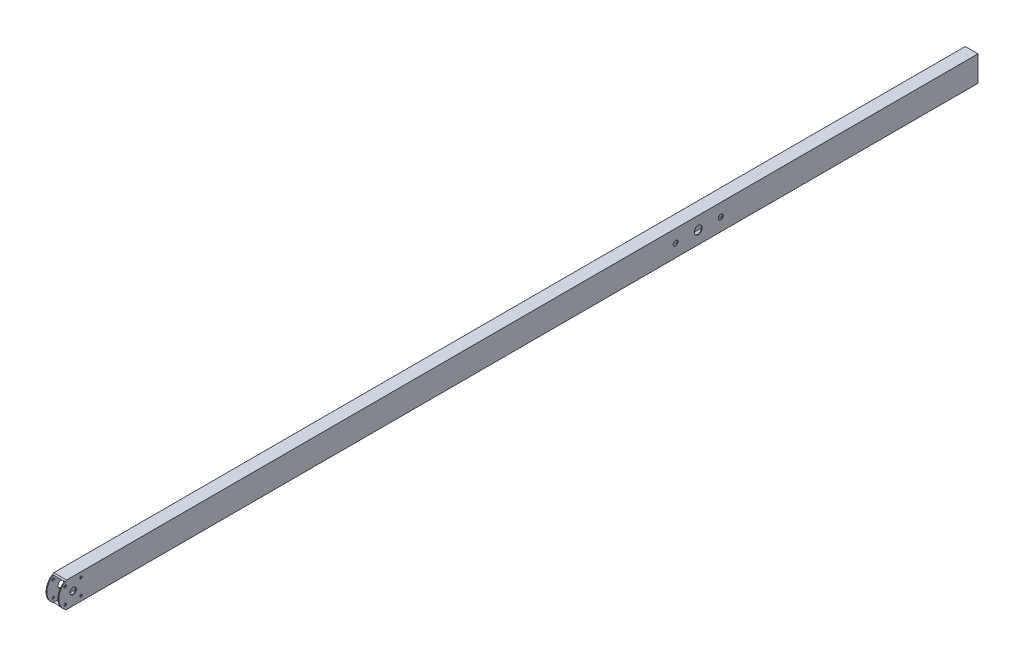
from build123d import *

# Parameters (mm, degrees)
SKETCH2_W                      = 25.4
SKETCH2_H                      = 50.8
SKETCH2_W_2                    = 22.225
SKETCH2_H_2                    = 47.625
EXTRUDE_THIN2_DEPTH            = 1828.8
CUT_EXTRUDE1_DEPTH             = 1830.152743759
F_1_2_0_5_DIAMETER_HOLE2_D     = 12.7
F_5_8_0_625_DIAMETER_HOLE1_D   = 15.875
F_3_8_0_375_DIAMETER_HOLE1_D   = 9.525
F_3_16_0_1875_DIAMETER_HOLE1_D = 4.7625


with BuildPart() as part:
    # Sketch2 → Extrude-Thin2 (new body)
    with BuildSketch(Plane.XY):
        Rectangle(SKETCH2_W, SKETCH2_H)
        Rectangle(SKETCH2_W_2, SKETCH2_H_2, mode=Mode.SUBTRACT)
    extrude(amount=EXTRUDE_THIN2_DEPTH)

    # Sketch8 → Cut-Extrude1 (cut, through all)
    with BuildSketch(Plane(origin=(12.7, 0, 0), x_dir=(0, 0, -1), z_dir=(1, 0, 0))):
        with BuildLine():
            Line((-1828.8, -25.4), (-1813.315860361, -25.4))
            ThreePointArc((-1813.315860361, -25.4), (-1824.623790462, -14.873790674), (-1828.8, -3.09e-07))
            Line((-1828.8, -3.09e-07), (-1828.8, -25.4))
        make_face()
        with BuildLine():
            Line((-1828.8, 25.4), (-1828.8, -3.09e-07))
            ThreePointArc((-1828.8, -3.09e-07), (-1824.623790622, 14.87379041), (-1813.315860361, 25.4))
            Line((-1813.315860361, 25.4), (-1828.8, 25.4))
        make_face()
    extrude(amount=-CUT_EXTRUDE1_DEPTH, mode=Mode.SUBTRACT)

    # 1/2 (0.5) Diameter Hole2 (through all)
    with Locations(Plane(origin=(12.7, 0, 0), x_dir=(0, 0, -1), z_dir=(1, 0, 0))):
        with Locations((-1800.225, 0)):
            Hole(F_1_2_0_5_DIAMETER_HOLE2_D / 2)

    # 5/8 (0.625) Diameter Hole1 (through all)
    with Locations(Plane(origin=(12.7, 0, 0), x_dir=(0, 0, -1), z_dir=(1, 0, 0))):
        with Locations((-556.5902, 0)):
            Hole(F_5_8_0_625_DIAMETER_HOLE1_D / 2)

    # 3/8 (0.375) Diameter Hole1 (through all)
    with Locations(Plane(origin=(12.7, 0, 0), x_dir=(0, 0, -1), z_dir=(1, 0, 0))):
        with Locations((-601.6355125, 0), (-511.5448875, 0)):
            Hole(F_3_8_0_375_DIAMETER_HOLE1_D / 2)

    # 3/16 (0.1875) Diameter Hole1 (through all)
    with Locations(Plane(origin=(12.7, 0, 0), x_dir=(0, 0, -1), z_dir=(1, 0, 0))):
        with Locations((-1784.509551788, 15.715448212), (-1784.509551788, -15.715448212), (-1815.940448212, -15.715448212), (-1815.940448212, 15.715448212)):
            Hole(F_3_16_0_1875_DIAMETER_HOLE1_D / 2)


solid = part.part
